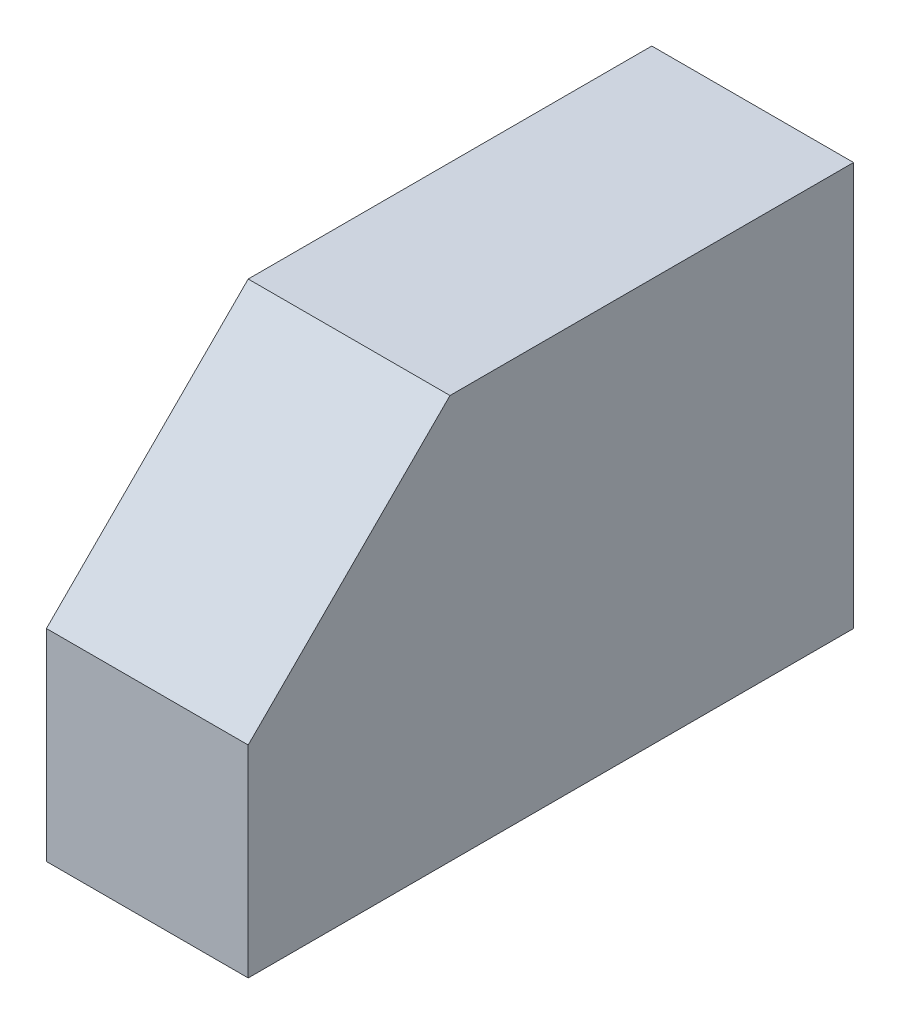
from build123d import *

# Parameters (mm, degrees)
SKETCH2_W           = 50
SKETCH2_H           = 100
BOSS_EXTRUDE1_DEPTH = 150
CUT_EXTRUDE1_DEPTH  = 150


with BuildPart() as part:
    # Sketch2 → Boss-Extrude1 (new body)
    with BuildSketch(Plane.XY):
        Rectangle(SKETCH2_W, SKETCH2_H)
    extrude(amount=BOSS_EXTRUDE1_DEPTH)

    # Sketch3 → Cut-Extrude1 (cut)
    with BuildSketch(Plane.ZY.offset(25)):
        Polygon((100, 50), (150, 0), (150, 50), align=None)
    extrude(amount=-CUT_EXTRUDE1_DEPTH, mode=Mode.SUBTRACT)


solid = part.part
